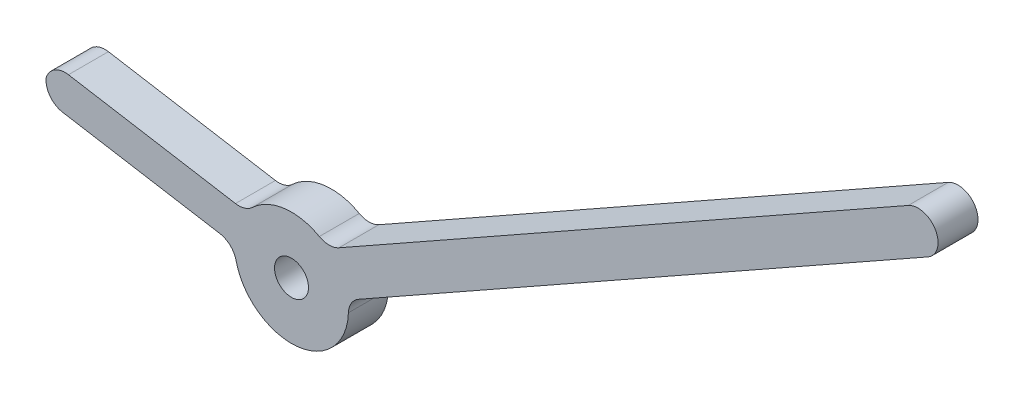
from build123d import *

# Parameters (mm, degrees)
SKETCH1_R               = 31.877
SKETCH1_R_2             = 2.159
BOSS_EXTRUDE1_DEPTH     = 5.08
BOSS_EXTRUDE4_START     = -5.08
BOSS_EXTRUDE4_DEPTH     = 5.08
CUT_EXTRUDE1_DEPTH      = 96.088150113
CUT_EXTRUDE1_DEPTH_BACK = 96.088150113
FILLET1_R               = 2.54


with BuildPart() as part:
    # Sketch1 → Boss-Extrude1 (new body)
    with BuildSketch(Plane.XY):
        Circle(SKETCH1_R)
        Circle(SKETCH1_R_2, mode=Mode.SUBTRACT)
        with BuildLine():
            ThreePointArc((19.487155783, 19.487155783), (-5.258505104, 27.052663549), (-25.368193256, 10.76815917))
            ThreePointArc((-25.368193256, 10.76815917), (-24.224411784, 7.937200685), (-21.393453299, 9.080982157))
            ThreePointArc((-21.393453299, 9.080982157), (-4.434591862, 22.813997371), (16.433868702, 16.433868702))
            ThreePointArc((16.433868702, 16.433868702), (19.487155783, 16.433868702), (19.487155783, 19.487155783))
        make_face(mode=Mode.SUBTRACT)
    extrude(amount=BOSS_EXTRUDE1_DEPTH)

    # Sketch2 → Boss-Extrude4 (add)
    with BuildSketch(Plane.XY.offset(5.08).offset(BOSS_EXTRUDE4_START)):
        with BuildLine():
            ThreePointArc((26.423537131, 17.830866902), (27.113483126, 16.763119094), (27.760306855, 15.668710614))
            ThreePointArc((27.760306855, 15.668710614), (28.362979586, 14.549382048), (28.920542807, 13.406913618))
            Line((28.920542807, 13.406913618), (80.920581905, 42.757221913))
            ThreePointArc((80.920581905, 42.757221913), (81.884055709, 46.217701392), (78.423576229, 47.181175196))
            Line((78.423576229, 47.181175196), (26.423537131, 17.830866902))
        make_face()
    extrude(amount=BOSS_EXTRUDE4_DEPTH)

    # Sketch6 → Cut-Extrude1 (cut, two sides: drawn at the far end of the back side and taken through both)
    # profile 1 of 2: a face of its own
    with BuildSketch(Plane.XY.offset(5.08).offset(-CUT_EXTRUDE1_DEPTH_BACK)):
        with BuildLine():
            ThreePointArc((7.239, 0), (0, -7.239), (-7.239, 0))
            Line((-7.239, 0), (-31.612710273, 4.096300546))
            ThreePointArc((-31.612710273, 4.096300546), (4.846010768, -31.506496293), (28.920542807, 13.406913618))
            Line((28.920542807, 13.406913618), (7.151828818, 1.120029266))
            ThreePointArc((7.151828818, 1.120029266), (7.217174302, 0.561708192), (7.239, 0))
        make_face()
    # profile 2 of 2: a face of its own
    with BuildSketch(Plane.XY.offset(5.08).offset(-CUT_EXTRUDE1_DEPTH_BACK)):
        with BuildLine():
            Line((-30.702053839, 8.574789739), (-5.761160237, 4.383167088))
            ThreePointArc((-5.761160237, 4.383167088), (-0.801790855, 7.194459842), (4.654823143, 5.54398255))
            Line((4.654823143, 5.54398255), (26.423537131, 17.830866902))
            ThreePointArc((26.423537131, 17.830866902), (-5.098545618, 31.466616621), (-30.702053839, 8.574789739))
        make_face()
        with BuildLine():
            ThreePointArc((-21.393453299, 9.080982157), (-24.224411784, 7.937200685), (-25.368193256, 10.76815917))
            ThreePointArc((-25.368193256, 10.76815917), (-5.258505104, 27.052663549), (19.487155783, 19.487155783))
            ThreePointArc((19.487155783, 19.487155783), (19.487155783, 16.433868702), (16.433868702, 16.433868702))
            ThreePointArc((16.433868702, 16.433868702), (-4.434591862, 22.813997371), (-21.393453299, 9.080982157))
        make_face(mode=Mode.SUBTRACT)
    extrude(amount=CUT_EXTRUDE1_DEPTH + CUT_EXTRUDE1_DEPTH_BACK, mode=Mode.SUBTRACT)

    # Fillet1
    # the kernel refuses this fillet: 2.54 mm, written as the material it adds along each edge
    with BuildSketch(Plane(origin=(7.151828818, 1.120029266, 0), x_dir=(0.8708569456123161, 0.49153655029792803, 0), z_dir=(0, 0, 1))) as fillet1_piece_1:
        with BuildLine():
            CenterArc((1.577227226, -2.54), FILLET1_R, 90, 58.70258778)
            ThreePointArc((-0.593157799, -1.220519481), (-0.267916042, -0.624189545), (0, 0))
            Line((0, 0), (1.577227226, 0))
        make_face()
    extrude(amount=5.08)
    with BuildSketch(Plane(origin=(-7.239, 0, 5.08), x_dir=(0.11271886677940961, -0.9936269204646005, 0), z_dir=(0, 0, -1))) as fillet1_piece_2:
        with BuildLine():
            CenterArc((1.918249675, 2.523812378), FILLET1_R, 196.012174579, 67.515755227)
            Line((-0.523206212, 1.823174702), (0, 0))
            ThreePointArc((0, 0), (0.815971877, 0.046134723), (1.631943753, 0))
        make_face()
    extrude(amount=5.08)
    with BuildSketch(Plane(origin=(-5.761160237, 4.383167088, 0), x_dir=(-0.9861698342812768, 0.1657379194802423, 0), z_dir=(0, 0, 1))) as fillet1_piece_3:
        with BuildLine():
            CenterArc((1.384869379, -2.54), FILLET1_R, 90, 52.834345642)
            ThreePointArc((-0.639236805, -1.005531312), (-0.298894804, -0.515940071), (0, 0))
            Line((0, 0), (1.384869379, 0))
        make_face()
    extrude(amount=5.08)
    with BuildSketch(Plane(origin=(4.654823143, 5.54398255, 0), x_dir=(-0.822747868924725, 0.5684064955468259, 0), z_dir=(0, 0, 1))) as fillet1_piece_4:
        with BuildLine():
            CenterArc((1.595093986, -2.528818084), FILLET1_R, 95.378217341, 58.70258778)
            Line((-0.689410954, -1.418576138), (0, 0))
            ThreePointArc((0, 0), (0.678510128, -0.031868462), (1.357020257, 0))
        make_face()
    extrude(amount=5.08)
    # the kernel refuses this fillet: 2.54 mm, written as the material it takes off along each edge
    with BuildSketch(Plane(origin=(-31.612710273, 4.096300546, 11.72014543), x_dir=(0.16970739547813604, 0.9854944951241623, 0), z_dir=(0, 0, -1))) as fillet1_2_piece_1:
        with BuildLine():
            CenterArc((2.550239121, 2.537794777), FILLET1_R, 179.769297531, 92.618395473)
            Line((0.010259711, 2.548022104), (0, 0))
            ThreePointArc((0, 0), (1.328029086, -0.027675553), (2.656058172, 0))
        make_face()
    extrude(amount=18.360290859, mode=Mode.SUBTRACT)
    with BuildSketch(Plane(origin=(-30.702053839, 8.574789739, 11.264732426), x_dir=(-0.23142006646754307, -0.9728539216327177, 0), z_dir=(0, 0, -1))) as fillet1_2_piece_2:
        with BuildLine():
            CenterArc((2.375331497, -2.538087003), FILLET1_R, 87.776151747, 88.383261221)
            Line((-0.158964351, -2.367956016), (0, 0))
            ThreePointArc((0, 0), (1.236946485, 0.024008109), (2.47389297, 0))
        make_face()
    extrude(amount=17.449464851, mode=Mode.SUBTRACT)


solid = part.part
